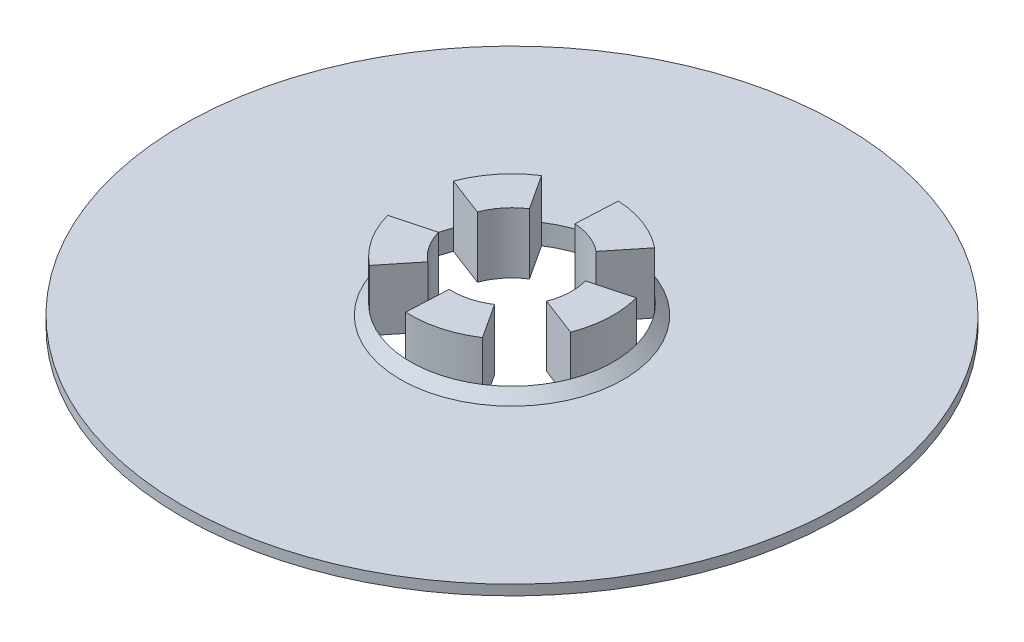
from build123d import *

# Parameters (mm, degrees)
SKETCH1_R           = 41.275
BOSS_EXTRUDE1_DEPTH = 1.27
SKETCH6_R           = 12.7
BOSS_EXTRUDE3_DEPTH = 6.35
CHAMFER2_SIZE       = 1.27
CUT_EXTRUDE2_DEPTH  = 59.866931719


with BuildPart() as part:
    # Sketch1 → Boss-Extrude1 (new body)
    with BuildSketch(Plane(origin=(0, 0, 0), x_dir=(1, 0, 0), z_dir=(0, 1, 0))):
        Circle(SKETCH1_R)
    extrude(amount=BOSS_EXTRUDE1_DEPTH)

    # Sketch6 → Boss-Extrude3 (add)
    with BuildSketch(Plane(origin=(0, 1.27, 0), x_dir=(1, 0, 0), z_dir=(0, 1, 0))):
        Circle(SKETCH6_R)
    extrude(amount=BOSS_EXTRUDE3_DEPTH)

    # Chamfer2
    chamfer2_edges = [part.edges().sort_by_distance(p)[0] for p in [
        (-12.7, 1.27, 0),
    ]]
    chamfer(chamfer2_edges, length=CHAMFER2_SIZE)

    # Sketch4 → Cut-Extrude2 (cut, through all)
    with BuildSketch(Plane.XZ):
        with BuildLine():
            ThreePointArc((11.86615569, 4.52596389), (9.886784934, 7.971291217), (6.939626784, 10.636333019))
            Line((6.939626784, 10.636333019), (4.098204794, 6.281299027))
            ThreePointArc((4.098204794, 6.281299027), (1.956596228, 7.240285298), (-0.376537609, 7.490541998))
            Line((-0.376537609, 7.490541998), (-0.637603684, 12.683984451))
            ThreePointArc((-0.637603684, 12.683984451), (-4.52596389, 11.86615569), (-7.971291217, 9.886784934))
            Line((-7.971291217, 9.886784934), (-4.707455443, 5.83865252))
            ThreePointArc((-4.707455443, 5.83865252), (-6.281299027, 4.098204794), (-7.240285298, 1.956596228))
            Line((-7.240285298, 1.956596228), (-12.260216438, 3.313169613))
            ThreePointArc((-12.260216438, 3.313169613), (-12.683984451, -0.637603684), (-11.86615569, -4.52596389))
            Line((-11.86615569, -4.52596389), (-7.007572258, -2.672813321))
            ThreePointArc((-7.007572258, -2.672813321), (-5.83865252, -4.707455443), (-4.098204794, -6.281299027))
            Line((-4.098204794, -6.281299027), (-6.939626784, -10.636333019))
            ThreePointArc((-6.939626784, -10.636333019), (-3.313169613, -12.260216438), (0.637603684, -12.683984451))
            Line((0.637603684, -12.683984451), (0.376537609, -7.490541998))
            ThreePointArc((0.376537609, -7.490541998), (2.672813321, -7.007572258), (4.707455443, -5.83865252))
            Line((4.707455443, -5.83865252), (7.971291217, -9.886784934))
            ThreePointArc((7.971291217, -9.886784934), (10.636333019, -6.939626784), (12.260216438, -3.313169613))
            Line((12.260216438, -3.313169613), (7.240285298, -1.956596228))
            ThreePointArc((7.240285298, -1.956596228), (7.490541998, 0.376537609), (7.007572258, 2.672813321))
            Line((7.007572258, 2.672813321), (11.86615569, 4.52596389))
        make_face()
    extrude(amount=-CUT_EXTRUDE2_DEPTH, mode=Mode.SUBTRACT)


solid = part.part
